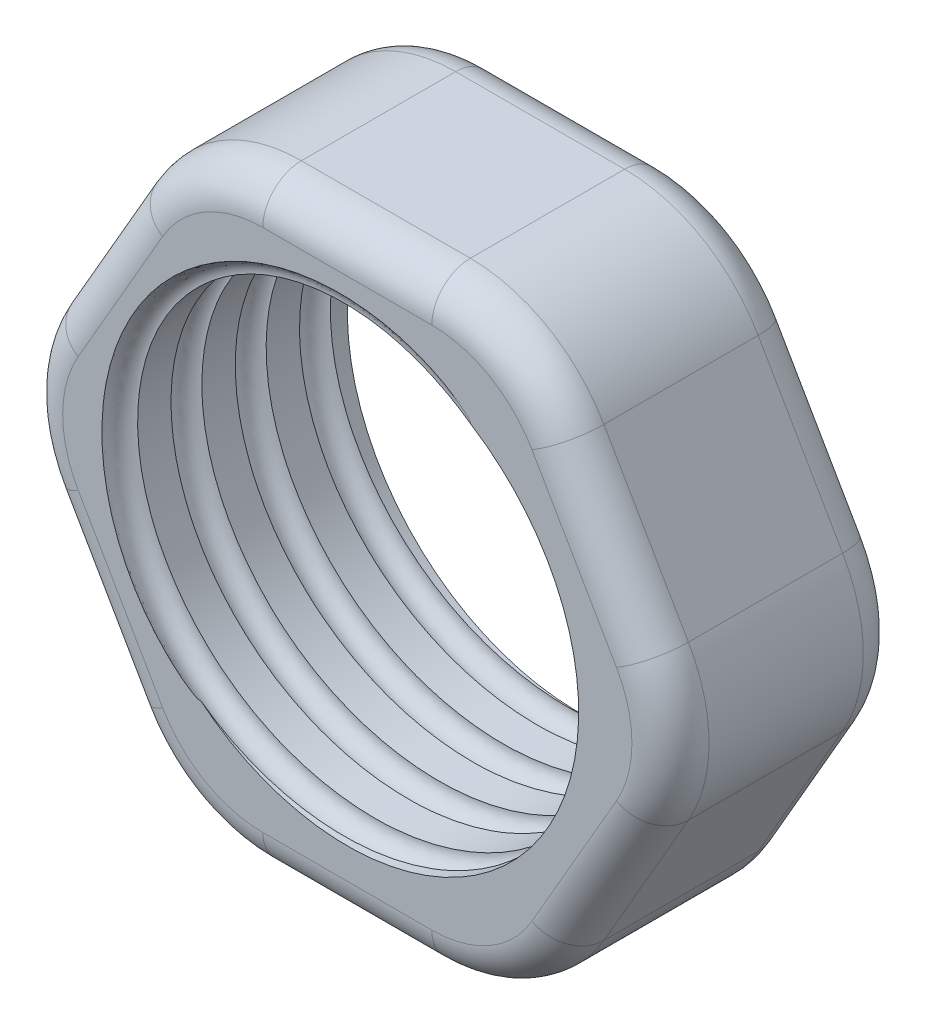
from build123d import *

# Parameters (mm, degrees)
SKETCH1_R           = 3
BOSS_EXTRUDE1_DEPTH = 3
CUT_SWEEP8_PITCH    = 0.8333333
FILLET1_R           = 0.5
FILLET6_R           = 0.5


with BuildPart() as part:
    # Sketch1 → Boss-Extrude1 (new body)
    with BuildSketch(Plane.XY):
        with BuildLine():
            Line((3.922649731, 1), (2.827350269, 2.897114317))
            ThreePointArc((2.827350269, 2.897114317), (2.095299462, 3.629165125), (1.095299462, 3.897114317))
            Line((1.095299462, 3.897114317), (-1.095299462, 3.897114317))
            ThreePointArc((-1.095299462, 3.897114317), (-2.095299462, 3.629165125), (-2.827350269, 2.897114317))
            Line((-2.827350269, 2.897114317), (-3.922649731, 1))
            ThreePointArc((-3.922649731, 1), (-4.190598923, 0), (-3.922649731, -1))
            Line((-3.922649731, -1), (-2.827350269, -2.897114317))
            ThreePointArc((-2.827350269, -2.897114317), (-2.095299462, -3.629165125), (-1.095299462, -3.897114317))
            Line((-1.095299462, -3.897114317), (1.095299462, -3.897114317))
            ThreePointArc((1.095299462, -3.897114317), (2.095299462, -3.629165125), (2.827350269, -2.897114317))
            Line((2.827350269, -2.897114317), (3.922649731, -1))
            ThreePointArc((3.922649731, -1), (4.190598923, 0), (3.922649731, 1))
        make_face()
        Circle(SKETCH1_R, mode=Mode.SUBTRACT)
    extrude(amount=BOSS_EXTRUDE1_DEPTH)

    # Cut-Sweep8: arcs per turn and ends read off the stored shape
    # Cut-Sweep8: the profile of Sketch4 screwed along a left-hand helix through 4.75 turns, 8 arcs to a turn; built about Z, then put on its axis
    cut_sweep8_z = Axis((0, 0, 0), (0, 0, 1))
    cut_sweep8_corners = [(3, 0, -0.199999998), (2.8, 0, 2e-09), (3, 0, 0.200000002), (3.2, 0, 2e-09)]
    with BuildLine(mode=Mode.PRIVATE) as cut_sweep8_profile:
        ThreePointArc((3, 0, -0.199999998), (2.858578644, 0, -0.141421354), (2.8, 0, 2e-09))
        ThreePointArc((2.8, 0, 2e-09), (2.858578644, 0, 0.141421358), (3, 0, 0.200000002))
        ThreePointArc((3, 0, 0.200000002), (3.141421356, 0, 0.141421358), (3.2, 0, 2e-09))
        ThreePointArc((3.2, 0, 2e-09), (3.141421356, 0, -0.141421354), (3, 0, -0.199999998))
    cut_sweep8_cap = Face(cut_sweep8_profile.wire())
    cut_sweep8_arcs = [((3, 0, -0.199999998), (2.8, 0, -0.199999998), (2.8, 0, 2e-09), (1, 0.7071067811865476, 1)), ((2.8, 0, 2e-09), (2.8, 0, 0.200000002), (3, 0, 0.200000002), (1, 0.7071067811865476, 1)), ((3, 0, 0.200000002), (3.2, 0, 0.200000002), (3.2, 0, 2e-09), (1, 0.7071067811865476, 1)), ((3.2, 0, 2e-09), (3.2, 0, -0.199999998), (3, 0, -0.199999998), (1, 0.7071067811865476, 1))]  # start, shoulder, end, weights
    cut_sweep8_turn_angles = [0, -22.5, -45, -67.5, -90, -112.5, -135, -157.5, -180, -202.5, -225, -247.5, -270, -292.5, -315, -337.5, -360]
    cut_sweep8_turn_weights = [1, 0.9238795325112867, 1, 0.9238795325112867, 1, 0.9238795325112867, 1, 0.9238795325112867, 1, 0.9238795325112867, 1, 0.9238795325112867, 1, 0.9238795325112867, 1, 0.9238795325112867, 1]
    cut_sweep8_turn_sides = [Face.make_bezier_surface([[Vector(p[j][0], p[j][1], 0).rotate(cut_sweep8_z, cut_sweep8_turn_angles[2 * i + k]) / cut_sweep8_turn_weights[2 * i + k] + Vector(0, 0, p[j][2] + -CUT_SWEEP8_PITCH * cut_sweep8_turn_angles[2 * i + k] / 360) for k in range(3)] for j in range(3)], [[p[3][j] * cut_sweep8_turn_weights[2 * i + k] for k in range(3)] for j in range(3)]) for p in cut_sweep8_arcs for i in range(8)]
    cut_sweep8_last_angles = [-1440, -1462.5, -1485, -1507.5, -1530, -1552.5, -1575, -1597.5, -1620, -1642.5, -1665, -1687.5, -1710]
    cut_sweep8_last_weights = [1, 0.9238795325112867, 1, 0.9238795325112867, 1, 0.9238795325112867, 1, 0.9238795325112867, 1, 0.9238795325112867, 1, 0.9238795325112761, 1]
    cut_sweep8_last_sides = [Face.make_bezier_surface([[Vector(p[j][0], p[j][1], 0).rotate(cut_sweep8_z, cut_sweep8_last_angles[2 * i + k]) / cut_sweep8_last_weights[2 * i + k] + Vector(0, 0, p[j][2] + -CUT_SWEEP8_PITCH * cut_sweep8_last_angles[2 * i + k] / 360) for k in range(3)] for j in range(3)], [[p[3][j] * cut_sweep8_last_weights[2 * i + k] for k in range(3)] for j in range(3)]) for p in cut_sweep8_arcs for i in range(6)]
    cut_sweep8 = Plane(origin=(0, 0, 0), x_dir=(1, 0, 0), z_dir=(0, 0, 1)) * Solid(Shell([*[p.moved(Location((0, 0, CUT_SWEEP8_PITCH * i))) for i in range(4) for p in cut_sweep8_turn_sides], *cut_sweep8_last_sides, cut_sweep8_cap, cut_sweep8_cap.rotate(cut_sweep8_z, -1710).moved(Location((0, 0, -CUT_SWEEP8_PITCH * -1710 / 360)))]))
    add(cut_sweep8, mode=Mode.SUBTRACT)

    # Fillet1
    fillet1_edges = [part.edges().sort_by_distance(p)[0] for p in [
        (4.190598923, 0, 0),
        (3.375, -1.948557159, 0),
        (2.095299462, -3.629165125, 0),
        (0, -3.897114317, 0),
        (-2.095299462, -3.629165125, 0),
        (-3.375, -1.948557159, 0),
        (-4.190598923, 0, 0),
        (-3.375, 1.948557159, 0),
        (-2.095299462, 3.629165125, 0),
        (0, 3.897114317, 0),
        (2.095299462, 3.629165125, 0),
        (3.375, 1.948557159, 0),
    ]]
    fillet(fillet1_edges, radius=FILLET1_R)

    # Fillet6
    fillet6_edges = [part.edges().sort_by_distance(p)[0] for p in [
        (3.375, 1.948557159, 3),
        (2.095299462, 3.629165125, 3),
        (0, 3.897114317, 3),
        (-2.095299462, 3.629165125, 3),
        (-3.375, 1.948557159, 3),
        (-4.190598923, 0, 3),
        (-3.375, -1.948557159, 3),
        (-2.095299462, -3.629165125, 3),
        (0, -3.897114317, 3),
        (2.095299462, -3.629165125, 3),
        (3.375, -1.948557159, 3),
        (4.190598923, 0, 3),
    ]]
    fillet(fillet6_edges, radius=FILLET6_R)


solid = part.part
